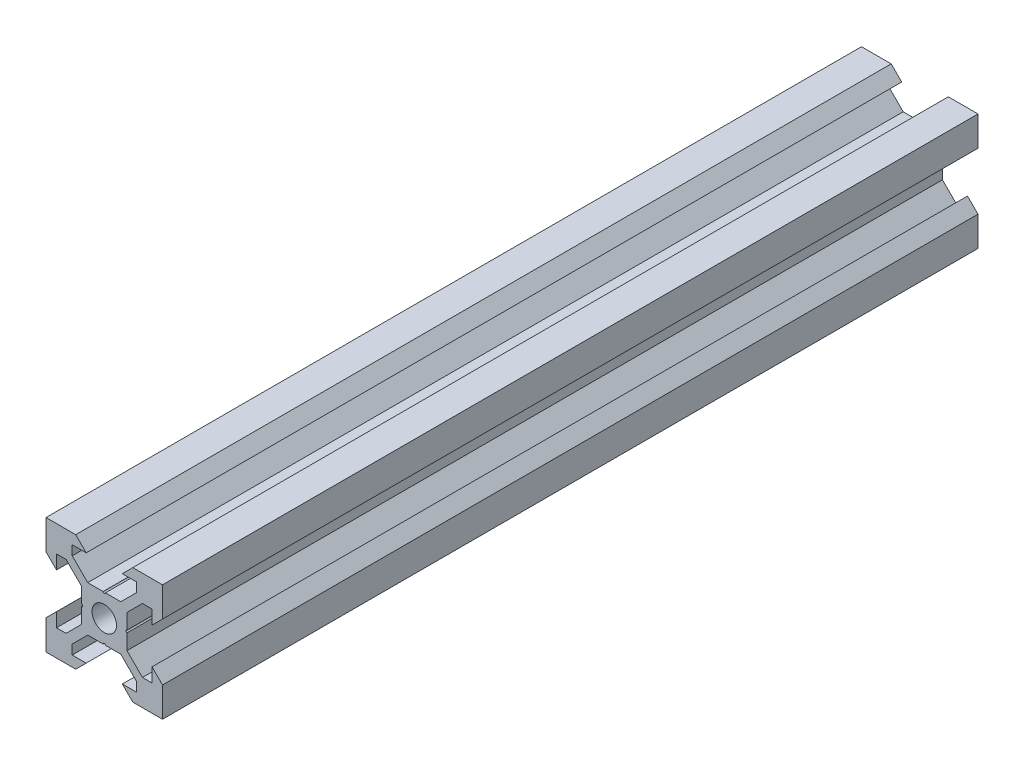
from build123d import *

# Parameters (mm, degrees)
SKETCH1_R           = 2.1
BOSS_EXTRUDE1_DEPTH = 140
CUT_EXTRUDE1_DEPTH  = 140


with BuildPart() as part:
    # Sketch1 → Boss-Extrude1 (new body)
    with BuildSketch(Plane.XY):
        Polygon((-10, -4.9), (-10, -10), (-4.9, -10), (-3.1, -8.2), (-5.499339828, -8.2), (-5.499339828, -6.56), (-2.84, -3.900660172), (2.84, -3.900660172), (5.499339828, -6.56), (5.499339828, -8.2), (3.1, -8.2), (4.9, -10), (10, -10), (10, -4.9), (8.2, -3.1), (8.2, -5.499339828), (6.56, -5.499339828), (3.900660172, -2.84), (3.900660172, 2.84), (6.56, 5.499339828), (8.2, 5.499339828), (8.2, 3.1), (10, 4.9), (10, 10), (4.9, 10), (3.1, 8.2), (5.499339828, 8.2), (5.499339828, 6.56), (2.84, 3.900660172), (-2.84, 3.900660172), (-5.499339828, 6.56), (-5.499339828, 8.2), (-3.1, 8.2), (-4.9, 10), (-10, 10), (-10, 4.9), (-8.2, 3.1), (-8.2, 5.499339828), (-6.56, 5.499339828), (-3.900660172, 2.84), (-3.900660172, -2.84), (-6.56, -5.499339828), (-8.2, -5.499339828), (-8.2, -3.1), align=None)
        Circle(SKETCH1_R, mode=Mode.SUBTRACT)
    extrude(amount=BOSS_EXTRUDE1_DEPTH)

    # Cut-Extrude1: read off the stored shape, not the designer's step
    # Cut-Extrude1 outline → Cut-Extrude1 (cut)
    with BuildSketch(Plane.XY):
        with BuildLine():
            ThreePointArc((-3.900660172, -0.2), (-3.700660172, 0), (-3.900660172, 0.2))
            Line((-3.900660172, 0.2), (-3.900660172, -0.2))
        make_face()
        with BuildLine():
            ThreePointArc((-0.2, 3.900660172), (0, 3.700660172), (0.2, 3.900660172))
            Line((0.2, 3.900660172), (-0.2, 3.900660172))
        make_face()
        with BuildLine():
            ThreePointArc((3.900660172, 0.2), (3.700660172, 0), (3.900660172, -0.2))
            Line((3.900660172, -0.2), (3.900660172, 0.2))
        make_face()
        with BuildLine():
            ThreePointArc((0.2, -3.900660172), (0, -3.700660172), (-0.2, -3.900660172))
            Line((-0.2, -3.900660172), (0.2, -3.900660172))
        make_face()
    extrude(amount=CUT_EXTRUDE1_DEPTH, mode=Mode.SUBTRACT)


solid = part.part
